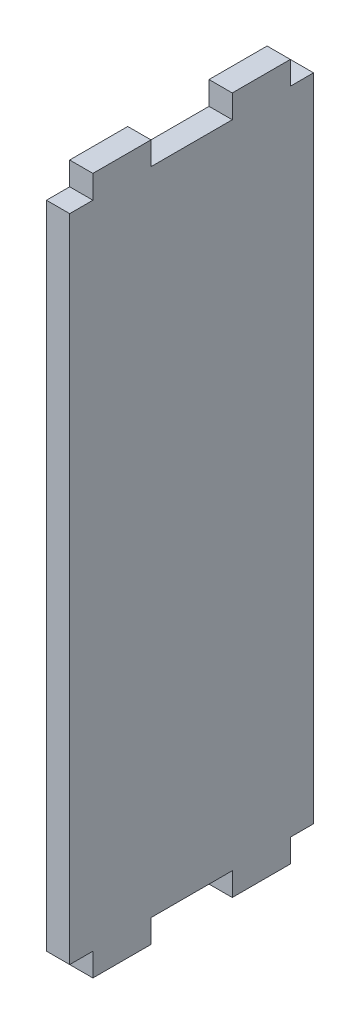
from build123d import *

# Parameters (mm, degrees)
BOSS_EXTRUDE1_DEPTH = 6.35


with BuildPart() as part:
    # Sketch1 → Boss-Extrude1 (new body)
    with BuildSketch(Plane(origin=(0, 0, 0), x_dir=(0, 0, -1), z_dir=(1, 0, 0))):
        Polygon((33.3375, -88.9), (33.3375, 88.9), (26.9875, 88.9), (26.9875, 95.25), (11.1125, 95.25), (11.1125, 88.9), (-11.1125, 88.9), (-11.1125, 95.25), (-26.9875, 95.25), (-26.9875, 88.9), (-33.3375, 88.9), (-33.3375, -88.9), (-26.9875, -88.9), (-26.9875, -95.25), (-11.1125, -95.25), (-11.1125, -88.9), (11.1125, -88.9), (11.1125, -95.25), (26.9875, -95.25), (26.9875, -88.9), align=None)
    extrude(amount=BOSS_EXTRUDE1_DEPTH)


solid = part.part
